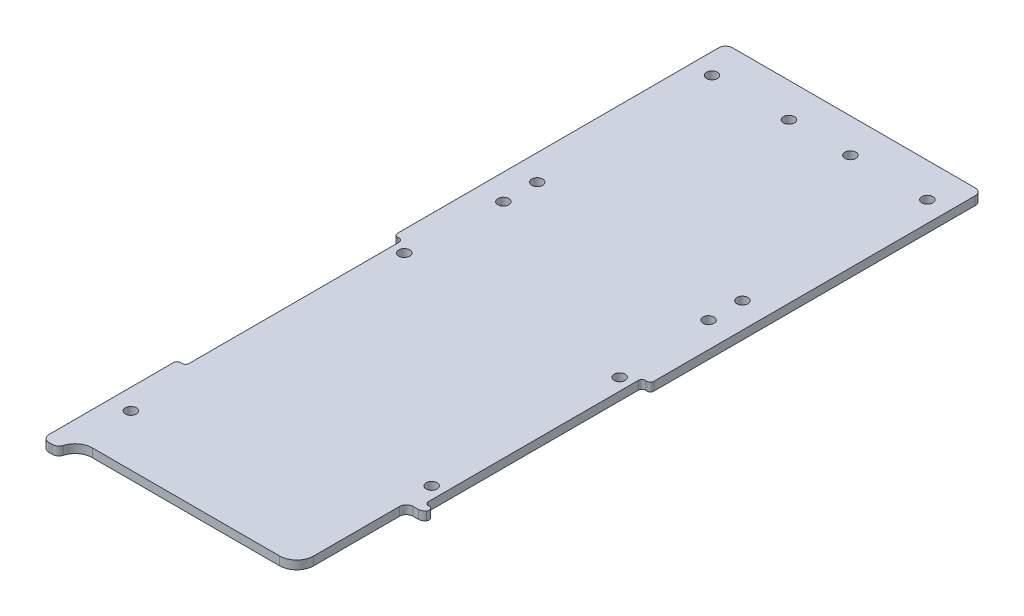
from build123d import *

# Parameters (mm, degrees)
SKETCH1_R               = 2.032
BOSS_EXTRUDE1_DEPTH     = 3.175
FILLET1_R               = 2.54
FILLET2_R               = 2.54
FILLET3_R               = 6.35
CUT_EXTRUDE1_DEPTH      = 136.673215063
FILLET4_R               = 6.35
FILLET5_R               = 2.54
SKETCH3_R               = 2.032
CUT_EXTRUDE2_DEPTH      = 136.673215063
CUT_EXTRUDE3_DEPTH      = 136.673215063
CUT_EXTRUDE3_DEPTH_BACK = 136.673215063
SKETCH4_W               = 3.175
SKETCH4_H               = 80.645
FILLET6_R               = 1.27


with BuildPart() as part:
    # Sketch1 → Boss-Extrude1 (new body)
    with BuildSketch(Plane(origin=(0, 0, 0), x_dir=(1, 0, 0), z_dir=(0, 1, 0))):
        Polygon((47.625, 127), (-47.625, 127), (-47.625, -127), (-41.275, -127), (-41.275, -120.65), (41.275, -120.65), (41.275, -127), (47.625, -127), align=None)
        with Locations((-39.999684148, -101.6)):
            Circle(SKETCH1_R, mode=Mode.SUBTRACT)
        with Locations((39.999684148, -69.85)):
            Circle(SKETCH1_R, mode=Mode.SUBTRACT)
        with Locations((-39.999684148, 0)):
            Circle(SKETCH1_R, mode=Mode.SUBTRACT)
        with Locations((-39.999684148, 114.3)):
            Circle(SKETCH1_R, mode=Mode.SUBTRACT)
        with Locations((-11.424684148, 114.3)):
            Circle(SKETCH1_R, mode=Mode.SUBTRACT)
        with Locations((39.999684148, 0)):
            Circle(SKETCH1_R, mode=Mode.SUBTRACT)
        with Locations((11.424684148, 114.3)):
            Circle(SKETCH1_R, mode=Mode.SUBTRACT)
        with Locations((39.999684148, 114.3)):
            Circle(SKETCH1_R, mode=Mode.SUBTRACT)
    extrude(amount=BOSS_EXTRUDE1_DEPTH)

    # Fillet1
    fillet1_edges = [part.edges().sort_by_distance(p)[0] for p in [
        (-47.625, 1.5875, -127),
        (47.625, 1.5875, -127),
        (47.625, 1.5875, 127),
        (-47.625, 1.5875, 127),
    ]]
    fillet(fillet1_edges, radius=FILLET1_R)

    # Fillet2
    fillet2_edges = [part.edges().sort_by_distance(p)[0] for p in [
        (41.275, 1.5875, 127),
        (-41.275, 1.5875, 127),
    ]]
    fillet(fillet2_edges, radius=FILLET2_R)

    # Fillet3
    fillet3_edges = [part.edges().sort_by_distance(p)[0] for p in [
        (41.275, 1.5875, 120.65),
        (-41.275, 1.5875, 120.65),
    ]]
    fillet(fillet3_edges, radius=FILLET3_R)

    # Sketch2 → Cut-Extrude1 (cut, through all)
    with BuildSketch(Plane.XZ):
        with BuildLine():
            Line((40.64508, 123.578690235), (40.64508, 79.88808))
            Line((40.64508, 79.88808), (47.625, 79.88808))
            Line((47.625, 79.88808), (47.625, 124.46))
            ThreePointArc((47.625, 124.46), (46.881051224, 126.256051224), (45.085, 127))
            Line((45.085, 127), (43.815, 127))
            ThreePointArc((43.815, 127), (42.297059666, 126.496530663), (41.380880287, 125.185714286))
            ThreePointArc((41.380880287, 125.185714286), (41.069166069, 124.356476684), (40.64508, 123.578690235))
        make_face()
    extrude(amount=-CUT_EXTRUDE1_DEPTH, mode=Mode.SUBTRACT)

    # Fillet4
    fillet4_edges = [part.edges().sort_by_distance(p)[0] for p in [
        (40.64508, 1.5875, 123.578690235),
    ]]
    fillet(fillet4_edges, radius=FILLET4_R)

    # Fillet5
    fillet5_edges = [part.edges().sort_by_distance(p)[0] for p in [
        (47.625, 1.5875, 79.88808),
        (40.64508, 1.5875, 79.88808),
    ]]
    fillet(fillet5_edges, radius=FILLET5_R)

    # Sketch3 → Cut-Extrude2 (cut, through all)
    with BuildSketch(Plane.XZ):
        with Locations((-38.109373556, -34.913768806)):
            Circle(SKETCH3_R)
        with Locations((-38.109373556, -47.490173279)):
            Circle(SKETCH3_R)
        with Locations((38.109373556, -47.490173279)):
            Circle(SKETCH3_R)
        with Locations((38.109373556, -34.913768806)):
            Circle(SKETCH3_R)
    extrude(amount=-CUT_EXTRUDE2_DEPTH, mode=Mode.SUBTRACT)

    # Sketch4 → Cut-Extrude3 (cut, two sides: drawn at the far end of the back side and taken through both)
    with BuildSketch(Plane(origin=(0, 3.175, 0), x_dir=(1, 0, 0), z_dir=(0, 1, 0)).offset(-CUT_EXTRUDE3_DEPTH_BACK)):
        with Locations((-46.0375, -36.5125)):
            Rectangle(SKETCH4_W, SKETCH4_H)
        with Locations((46.0375, -36.5125)):
            Rectangle(SKETCH4_W, SKETCH4_H)
    extrude(amount=CUT_EXTRUDE3_DEPTH + CUT_EXTRUDE3_DEPTH_BACK, mode=Mode.SUBTRACT)

    # Fillet6
    fillet6_edges = [part.edges().sort_by_distance(p)[0] for p in [
        (-44.45, 1.5875, -3.81),
        (-47.625, 1.5875, -3.81),
        (-47.625, 1.5875, 76.835),
        (-44.45, 1.5875, 76.835),
        (44.45, 1.5875, 76.835),
        (47.625, 1.5875, 76.835),
        (44.45, 1.5875, -3.81),
        (47.625, 1.5875, -3.81),
    ]]
    fillet(fillet6_edges, radius=FILLET6_R)


solid = part.part
